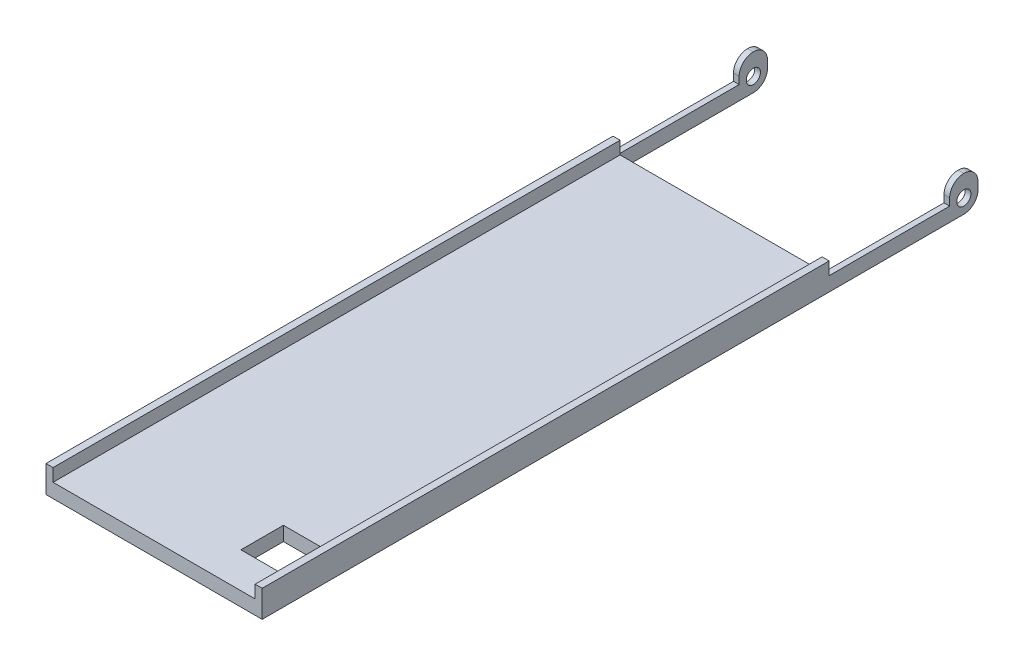
from build123d import *

# Parameters (mm, degrees)
SKETCH1_W           = 30.5
SKETCH1_H           = 85
BOSS_EXTRUDE1_DEPTH = 2
CUT_EXTRUDE1_DEPTH  = 2
SKETCH5_W           = 0.8
SKETCH5_H           = 4
BOSS_EXTRUDE2_DEPTH = 3
SKETCH6_R           = 1
CUT_EXTRUDE2_DEPTH  = 0.8
FILLET1_R           = 2
FILLET2_R           = 2
SKETCH7_W           = 30.5
SKETCH7_H           = 2
BOSS_EXTRUDE3_DEPTH = 16
SKETCH8_W           = 30.5
SKETCH8_H           = 80
BOSS_EXTRUDE4_DEPTH = 1.8
SKETCH9_W           = 28.5
SKETCH9_H           = 80
CUT_EXTRUDE3_DEPTH  = 1.8
SKETCH10_W          = 28.9
SKETCH10_H          = 2
CUT_EXTRUDE4_DEPTH  = 1
SKETCH11_W          = 7
SKETCH11_H          = 6
CUT_EXTRUDE5_DEPTH  = 2


with BuildPart() as part:
    # Sketch1 → Boss-Extrude1 (new body)
    with BuildSketch(Plane(origin=(0, 0, 0), x_dir=(1, 0, 0), z_dir=(0, 1, 0))):
        Rectangle(SKETCH1_W, SKETCH1_H)
    extrude(amount=BOSS_EXTRUDE1_DEPTH)

    # Sketch2 → Cut-Extrude1 (cut)
    with BuildSketch(Plane(origin=(0, 2, 0), x_dir=(1, 0, 0), z_dir=(0, 1, 0))):
        Polygon((14.45, 42.5), (-14.45, 42.5), (-14.45, 24.5), (-14.45, 22.5), (14.45, 22.5), (14.45, 24.5), align=None)
    extrude(amount=-CUT_EXTRUDE1_DEPTH, mode=Mode.SUBTRACT)

    # Sketch5 → Boss-Extrude2 (add)
    with BuildSketch(Plane(origin=(0, 2, 0), x_dir=(1, 0, 0), z_dir=(0, 1, 0))):
        with Locations((-14.85, 40.5)):
            Rectangle(SKETCH5_W, SKETCH5_H)
    boss_extrude2 = extrude(amount=BOSS_EXTRUDE2_DEPTH)

    # Sketch6 → Cut-Extrude2 (cut)
    with BuildSketch(Plane.ZY.offset(15.25)):
        with Locations((-40.5, 2)):
            Circle(SKETCH6_R)
    cut_extrude2 = extrude(amount=-CUT_EXTRUDE2_DEPTH, mode=Mode.SUBTRACT)

    # Mirror1: Boss-Extrude2, Cut-Extrude2 across plane
    add(boss_extrude2.mirror(Plane(origin=(0, 0, 0), x_dir=(0, 0, 1), z_dir=(1, 0, 0))))
    add(cut_extrude2.mirror(Plane(origin=(0, 0, 0), x_dir=(0, 0, 1), z_dir=(1, 0, 0))), mode=Mode.SUBTRACT)

    # Fillet1
    fillet1_edges = [part.edges().sort_by_distance(p)[0] for p in [
        (-14.85, 0, -42.5),
        (-14.85, 5, -42.5),
        (-14.85, 5, -38.5),
    ]]
    fillet(fillet1_edges, radius=FILLET1_R - 0.0001)  # a hair under: the kernel refuses the full size

    # Fillet2
    fillet2_edges = [part.edges().sort_by_distance(p)[0] for p in [
        (14.85, 0, -42.5),
        (14.85, 5, -38.5),
        (14.85, 5, -42.5),
    ]]
    fillet(fillet2_edges, radius=FILLET2_R - 0.0001)  # a hair under: the kernel refuses the full size

    # Sketch7 → Boss-Extrude3 (add)
    with BuildSketch(Plane.XY.offset(42.5)):
        with Locations((0, 1)):
            Rectangle(SKETCH7_W, SKETCH7_H)
    extrude(amount=BOSS_EXTRUDE3_DEPTH)

    # Sketch8 → Boss-Extrude4 (add)
    with BuildSketch(Plane(origin=(0, 2, 0), x_dir=(1, 0, 0), z_dir=(0, 1, 0))):
        with Locations((0, -18.5)):
            Rectangle(SKETCH8_W, SKETCH8_H)
    extrude(amount=BOSS_EXTRUDE4_DEPTH)

    # Sketch9 → Cut-Extrude3 (cut)
    with BuildSketch(Plane(origin=(0, 3.8, 0), x_dir=(1, 0, 0), z_dir=(0, 1, 0))):
        with Locations((0, -18.5)):
            Rectangle(SKETCH9_W, SKETCH9_H)
    extrude(amount=-CUT_EXTRUDE3_DEPTH, mode=Mode.SUBTRACT)

    # Sketch10 → Cut-Extrude4 (cut)
    with BuildSketch(Plane(origin=(0, 0, -22.5), x_dir=(-1, 0, 0), z_dir=(0, 0, -1))):
        with Locations((0, 1)):
            Rectangle(SKETCH10_W, SKETCH10_H)
    extrude(amount=-CUT_EXTRUDE4_DEPTH, mode=Mode.SUBTRACT)

    # Sketch11 → Cut-Extrude5 (cut)
    with BuildSketch(Plane(origin=(0, 2, 0), x_dir=(1, 0, 0), z_dir=(0, 1, 0))):
        with Locations((10.75, -50.5)):
            Rectangle(SKETCH11_W, SKETCH11_H)
    extrude(amount=-CUT_EXTRUDE5_DEPTH, mode=Mode.SUBTRACT)


solid = part.part
